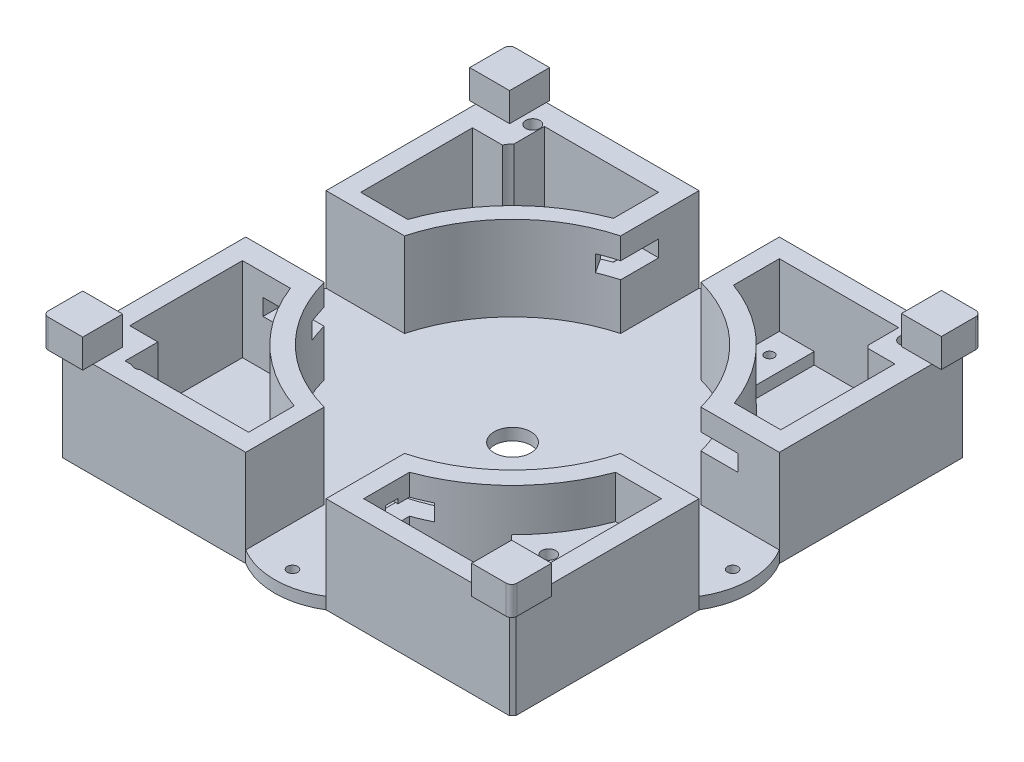
from build123d import *

# Parameters (mm, degrees)
BOSS_EXTRUDE1_DEPTH                  = 20.5
CUT_EXTRUDE4_REACH                   = 102.939
SKETCH2_R                            = 4.5
SKETCH2_R_2                          = 1.5
SKETCH2_R_3                          = 1.1
SKETCH2_R_4                          = 3.9
SKETCH2_R_5                          = 4.9
SKETCH2_R_6                          = 1
CUT_EXTRUDE7_START                   = -18
SKETCH3_R                            = 1.1
SKETCH3_R_2                          = 3.9
CUT_EXTRUDE7_DEPTH                   = 18
CUT_EXTRUDE8_START                   = -17.9
CUT_EXTRUDE8_DEPTH                   = 17.9
CUT_EXTRUDE9_DEPTH                   = 13.4
CUT_EXTRUDE10_DEPTH                  = 2.5
CUT_EXTRUDE11_START                  = -13.4
SKETCH7_R                            = 1
CUT_EXTRUDE11_DEPTH                  = 13.4
CUT_EXTRUDE12_START                  = -2.5
CUT_EXTRUDE12_DEPTH                  = 2.5
CUT_EXTRUDE13_START                  = -9.1
CUT_EXTRUDE13_DEPTH                  = 9.1
CUT_EXTRUDE14_START                  = -6.9
CUT_EXTRUDE14_DEPTH                  = 6.9
SKETCH11_W                           = 2.6
SKETCH11_H                           = 3.5
SKETCH11_W_2                         = 4.5
SKETCH11_H_2                         = 1
SKETCH11_W_3                         = 5.4
CUT_EXTRUDE15_DEPTH                  = 4
CUT_EXTRUDE16_REACH                  = 109.549
CUT_EXTRUDE16_END_RADIUS             = 32.7
SKETCH12_W                           = 6.7
SKETCH12_H                           = 3.5
CUT_EXTRUDE16_DIRECTION_2_REACH      = 109.549
CUT_EXTRUDE16_DIRECTION_2_END_RADIUS = 36.7
CUT_EXTRUDE17_REACH                  = 110.321
CUT_EXTRUDE17_END_RADIUS             = 36.7
SKETCH13_W                           = 6.711690568
SKETCH13_H                           = 3.5
SKETCH14_W                           = 8.3
SKETCH14_H                           = 3.5
CUT_EXTRUDE18_DEPTH                  = 4.7
CUT_EXTRUDE19_REACH                  = 120.941
CUT_EXTRUDE19_END_RADIUS             = 36.537172852
SKETCH15_W                           = 4.2
SKETCH15_H                           = 3.5
CUT_EXTRUDE19_DIRECTION_2_REACH      = 120.941
CUT_EXTRUDE19_DIRECTION_2_END_RADIUS = 32.7
CUT_EXTRUDE20_START                  = -0.346724082
CUT_EXTRUDE20_OUTLINE_W              = 1.5
CUT_EXTRUDE20_OUTLINE_H              = 3.5
CUT_EXTRUDE20_DEPTH                  = 3.492022821
CUT_EXTRUDE21_REACH                  = 95.558
SKETCH17_W                           = 3.89836408
SKETCH17_H                           = 3.5
CIRPATTERN1_START                    = 12.4
CIRPATTERN1_DEPTH                    = 3.5
SKETCH18_W                           = 8.1
SKETCH18_H                           = 3.5
CUT_EXTRUDE22_DEPTH                  = 4
CUT_EXTRUDE23_REACH                  = 82.562
SKETCH19_W                           = 7.9
SKETCH19_H                           = 3.5
BOSS_EXTRUDE2_DEPTH                  = 6.1


# Read off the part's stored shape, not the designer's step: Cut-Extrude20, CirPattern1
with BuildPart() as part:
    # Sketch1 → Boss-Extrude1 (new body)
    with BuildSketch(Plane(origin=(0, 0, 0), x_dir=(1, 0, 0), z_dir=(0, 1, 0))):
        with BuildLine():
            ThreePointArc((8.55, 14.0296875), (0, 16.4296875), (-8.55, 14.0296875))
            Line((-8.55, 14.0296875), (-47.55, 14.0296875))
            Line((-47.55, 14.0296875), (-48.25, 13.3296875))
            Line((-48.25, 13.3296875), (-48.25, -25.6703125))
            ThreePointArc((-48.25, -25.6703125), (-50.65, -34.2203125), (-48.25, -42.7703125))
            Line((-48.25, -42.7703125), (-48.25, -81.7703125))
            Line((-48.25, -81.7703125), (-47.55, -82.4703125))
            Line((-47.55, -82.4703125), (-8.55, -82.4703125))
            ThreePointArc((-8.55, -82.4703125), (0, -84.8703125), (8.55, -82.4703125))
            Line((8.55, -82.4703125), (47.55, -82.4703125))
            Line((47.55, -82.4703125), (48.25, -81.7703125))
            Line((48.25, -81.7703125), (48.25, -42.7703125))
            ThreePointArc((48.25, -42.7703125), (50.65, -34.2203125), (48.25, -25.6703125))
            Line((48.25, -25.6703125), (48.25, 13.3296875))
            Line((48.25, 13.3296875), (47.55, 14.0296875))
            Line((47.55, 14.0296875), (8.55, 14.0296875))
        make_face()
    extrude(amount=BOSS_EXTRUDE1_DEPTH)

    # Sketch2 → Cut-Extrude4 (cut, up to next)
    with BuildSketch(Plane.XZ, mode=Mode.PRIVATE) as cut_extrude4_sk1:
        with Locations(Location((34.75, 68.5703125, 0), (0, 0, 270))):
            Circle(SKETCH2_R)
    cut_extrude4_tool1 = extrude(cut_extrude4_sk1.sketch, amount=-CUT_EXTRUDE4_REACH, mode=Mode.PRIVATE) & part.part
    # Sketch2 → Cut-Extrude4 (cut, up to next)
    with BuildSketch(Plane.XZ, mode=Mode.PRIVATE) as cut_extrude4_sk2:
        with Locations(Location((33.45, 59.9703125, 0), (0, 0, 270))):
            Circle(SKETCH2_R_2)
    cut_extrude4_tool2 = extrude(cut_extrude4_sk2.sketch, amount=-CUT_EXTRUDE4_REACH, mode=Mode.PRIVATE) & part.part
    # Sketch2 → Cut-Extrude4 (cut, up to next)
    with BuildSketch(Plane.XZ, mode=Mode.PRIVATE) as cut_extrude4_sk3:
        with Locations(Location((37.85, 77.2703125, 0), (0, 0, 270))):
            Circle(SKETCH2_R_2)
    cut_extrude4_tool3 = extrude(cut_extrude4_sk3.sketch, amount=-CUT_EXTRUDE4_REACH, mode=Mode.PRIVATE) & part.part
    # Sketch2 → Cut-Extrude4 (cut, up to next)
    with BuildSketch(Plane.XZ, mode=Mode.PRIVATE) as cut_extrude4_sk4:
        with Locations(Location((-35.95, 77.2703125, 0), (0, 0, 270))):
            Circle(SKETCH2_R_2)
    cut_extrude4_tool4 = extrude(cut_extrude4_sk4.sketch, amount=-CUT_EXTRUDE4_REACH, mode=Mode.PRIVATE) & part.part
    # Sketch2 → Cut-Extrude4 (cut, up to next)
    with BuildSketch(Plane.XZ, mode=Mode.PRIVATE) as cut_extrude4_sk5:
        with Locations(Location((0, 81.0703125, 0), (0, 0, 270))):
            Circle(SKETCH2_R_3)
    cut_extrude4_tool5 = extrude(cut_extrude4_sk5.sketch, amount=-CUT_EXTRUDE4_REACH, mode=Mode.PRIVATE) & part.part
    # Sketch2 → Cut-Extrude4 (cut, up to next)
    with BuildSketch(Plane.XZ, mode=Mode.PRIVATE) as cut_extrude4_sk6:
        with Locations(Location((0, 34.2203125, 0), (0, 0, 270))):
            Circle(SKETCH2_R_4)
    cut_extrude4_tool6 = extrude(cut_extrude4_sk6.sketch, amount=-CUT_EXTRUDE4_REACH, mode=Mode.PRIVATE) & part.part
    # Sketch2 → Cut-Extrude4 (cut, up to next)
    with BuildSketch(Plane.XZ, mode=Mode.PRIVATE) as cut_extrude4_sk7:
        with Locations(Location((-34.25, -0.0296875, 0), (0, 0, 270))):
            Circle(SKETCH2_R_4)
    cut_extrude4_tool7 = extrude(cut_extrude4_sk7.sketch, amount=-CUT_EXTRUDE4_REACH, mode=Mode.PRIVATE) & part.part
    # Sketch2 → Cut-Extrude4 (cut, up to next)
    with BuildSketch(Plane.XZ, mode=Mode.PRIVATE) as cut_extrude4_sk8:
        with Locations(Location((34.55, -0.0296875, 0), (0, 0, 270))):
            Circle(SKETCH2_R_5)
    cut_extrude4_tool8 = extrude(cut_extrude4_sk8.sketch, amount=-CUT_EXTRUDE4_REACH, mode=Mode.PRIVATE) & part.part
    # Sketch2 → Cut-Extrude4 (cut, up to next)
    with BuildSketch(Plane.XZ, mode=Mode.PRIVATE) as cut_extrude4_sk9:
        with Locations(Location((41.15, -8.5296875, 0), (0, 0, 270))):
            Circle(SKETCH2_R_2)
    cut_extrude4_tool9 = extrude(cut_extrude4_sk9.sketch, amount=-CUT_EXTRUDE4_REACH, mode=Mode.PRIVATE) & part.part
    # Sketch2 → Cut-Extrude4 (cut, up to next)
    with BuildSketch(Plane.XZ, mode=Mode.PRIVATE) as cut_extrude4_sk10:
        with Locations(Location((-15.25, -4.6296875, 0), (0, 0, 270))):
            Circle(SKETCH2_R_6)
    cut_extrude4_tool10 = extrude(cut_extrude4_sk10.sketch, amount=-CUT_EXTRUDE4_REACH, mode=Mode.PRIVATE) & part.part
    # Sketch2 → Cut-Extrude4 (cut, up to next)
    with BuildSketch(Plane.XZ, mode=Mode.PRIVATE) as cut_extrude4_sk11:
        with Locations(Location((46.85, 34.2203125, 0), (0, 0, 270))):
            Circle(SKETCH2_R_3)
    cut_extrude4_tool11 = extrude(cut_extrude4_sk11.sketch, amount=-CUT_EXTRUDE4_REACH, mode=Mode.PRIVATE) & part.part
    # Sketch2 → Cut-Extrude4 (cut, up to next)
    with BuildSketch(Plane.XZ, mode=Mode.PRIVATE) as cut_extrude4_sk12:
        with Locations(Location((38.95, 18.3703125, 0), (0, 0, 270))):
            Circle(SKETCH2_R_6)
    cut_extrude4_tool12 = extrude(cut_extrude4_sk12.sketch, amount=-CUT_EXTRUDE4_REACH, mode=Mode.PRIVATE) & part.part
    # Sketch2 → Cut-Extrude4 (cut, up to next)
    with BuildSketch(Plane.XZ, mode=Mode.PRIVATE) as cut_extrude4_sk13:
        with Locations(Location((15.85, -4.6296875, 0), (0, 0, 270))):
            Circle(SKETCH2_R_6)
    cut_extrude4_tool13 = extrude(cut_extrude4_sk13.sketch, amount=-CUT_EXTRUDE4_REACH, mode=Mode.PRIVATE) & part.part
    # Sketch2 → Cut-Extrude4 (cut, up to next)
    with BuildSketch(Plane.XZ, mode=Mode.PRIVATE) as cut_extrude4_sk14:
        with Locations(Location((-46.85, 34.2203125, 0), (0, 0, 270))):
            Circle(SKETCH2_R_3)
    cut_extrude4_tool14 = extrude(cut_extrude4_sk14.sketch, amount=-CUT_EXTRUDE4_REACH, mode=Mode.PRIVATE) & part.part
    # Sketch2 → Cut-Extrude4 (cut, up to next)
    with BuildSketch(Plane.XZ, mode=Mode.PRIVATE) as cut_extrude4_sk15:
        with Locations(Location((-38.55, 18.6703125, 0), (0, 0, 270))):
            Circle(SKETCH2_R_3)
    cut_extrude4_tool15 = extrude(cut_extrude4_sk15.sketch, amount=-CUT_EXTRUDE4_REACH, mode=Mode.PRIVATE) & part.part
    # Sketch2 → Cut-Extrude4 (cut, up to next)
    with BuildSketch(Plane.XZ, mode=Mode.PRIVATE) as cut_extrude4_sk16:
        with Locations(Location((-38.45, -8.5296875, 0), (0, 0, 270))):
            Circle(SKETCH2_R_2)
    cut_extrude4_tool16 = extrude(cut_extrude4_sk16.sketch, amount=-CUT_EXTRUDE4_REACH, mode=Mode.PRIVATE) & part.part
    # Sketch2 → Cut-Extrude4 (cut, up to next)
    with BuildSketch(Plane.XZ, mode=Mode.PRIVATE) as cut_extrude4_sk17:
        with Locations(Location((0, -12.6296875, 0), (0, 0, 270))):
            Circle(SKETCH2_R_3)
    cut_extrude4_tool17 = extrude(cut_extrude4_sk17.sketch, amount=-CUT_EXTRUDE4_REACH, mode=Mode.PRIVATE) & part.part
    add(cut_extrude4_tool1.solids().sort_by_distance((34.75, 0, 68.570313))[0], mode=Mode.SUBTRACT)
    add(cut_extrude4_tool2.solids().sort_by_distance((33.45, 0, 59.970312))[0], mode=Mode.SUBTRACT)
    add(cut_extrude4_tool3.solids().sort_by_distance((37.85, 0, 77.270313))[0], mode=Mode.SUBTRACT)
    add(cut_extrude4_tool4.solids().sort_by_distance((-35.95, 0, 77.270313))[0], mode=Mode.SUBTRACT)
    add(cut_extrude4_tool5.solids().sort_by_distance((0, 0, 81.070312))[0], mode=Mode.SUBTRACT)
    add(cut_extrude4_tool6.solids().sort_by_distance((0, 0, 34.220313))[0], mode=Mode.SUBTRACT)
    add(cut_extrude4_tool7.solids().sort_by_distance((-34.25, 0, -0.029688))[0], mode=Mode.SUBTRACT)
    add(cut_extrude4_tool8.solids().sort_by_distance((34.55, 0, -0.029688))[0], mode=Mode.SUBTRACT)
    add(cut_extrude4_tool9.solids().sort_by_distance((41.15, 0, -8.529688))[0], mode=Mode.SUBTRACT)
    add(cut_extrude4_tool10.solids().sort_by_distance((-15.25, 0, -4.629688))[0], mode=Mode.SUBTRACT)
    add(cut_extrude4_tool11.solids().sort_by_distance((46.85, 0, 34.220313))[0], mode=Mode.SUBTRACT)
    add(cut_extrude4_tool12.solids().sort_by_distance((38.95, 0, 18.370312))[0], mode=Mode.SUBTRACT)
    add(cut_extrude4_tool13.solids().sort_by_distance((15.85, 0, -4.629688))[0], mode=Mode.SUBTRACT)
    add(cut_extrude4_tool14.solids().sort_by_distance((-46.85, 0, 34.220312))[0], mode=Mode.SUBTRACT)
    add(cut_extrude4_tool15.solids().sort_by_distance((-38.55, 0, 18.670313))[0], mode=Mode.SUBTRACT)
    add(cut_extrude4_tool16.solids().sort_by_distance((-38.45, 0, -8.529688))[0], mode=Mode.SUBTRACT)
    add(cut_extrude4_tool17.solids().sort_by_distance((0, 0, -12.629688))[0], mode=Mode.SUBTRACT)

    # Sketch3 → Cut-Extrude7 (cut)
    with BuildSketch(Plane(origin=(0, 20.5, 0), x_dir=(1, 0, 0), z_dir=(0, 1, 0)).offset(CUT_EXTRUDE7_START)):
        with BuildLine():
            Line((8.55, -82.4703125), (8.55, -65.782750619))
            ThreePointArc((8.55, -65.782750619), (23.122391745, -57.342704245), (31.562438119, -42.7703125))
            Line((31.562438119, -42.7703125), (48.25, -42.7703125))
            ThreePointArc((48.25, -42.7703125), (50.65, -34.2203125), (48.25, -25.6703125))
            Line((48.25, -25.6703125), (31.562438119, -25.6703125))
            ThreePointArc((31.562438119, -25.6703125), (23.122391745, -11.097920755), (8.55, -2.657874381))
            Line((8.55, -2.657874381), (8.55, 14.0296875))
            ThreePointArc((8.55, 14.0296875), (0, 16.4296875), (-8.55, 14.0296875))
            Line((-8.55, 14.0296875), (-8.55, -2.657874381))
            ThreePointArc((-8.55, -2.657874381), (-23.122391745, -11.097920755), (-31.562438119, -25.6703125))
            Line((-31.562438119, -25.6703125), (-48.25, -25.6703125))
            ThreePointArc((-48.25, -25.6703125), (-50.65, -34.2203125), (-48.25, -42.7703125))
            Line((-48.25, -42.7703125), (-31.562438119, -42.7703125))
            ThreePointArc((-31.562438119, -42.7703125), (-23.122391745, -57.342704245), (-8.55, -65.782750619))
            Line((-8.55, -65.782750619), (-8.55, -82.4703125))
            ThreePointArc((-8.55, -82.4703125), (0, -84.8703125), (8.55, -82.4703125))
        make_face()
        with Locations(Location((0, -81.0703125, 0), (0, 0, 90))):
            Circle(SKETCH3_R, mode=Mode.SUBTRACT)
        with Locations(Location((-46.85, -34.2203125, 0), (0, 0, 90))):
            Circle(SKETCH3_R, mode=Mode.SUBTRACT)
        with Locations(Location((46.85, -34.2203125, 0), (0, 0, 90))):
            Circle(SKETCH3_R, mode=Mode.SUBTRACT)
        with Locations(Location((0, 12.6296875, 0), (0, 0, 90))):
            Circle(SKETCH3_R, mode=Mode.SUBTRACT)
        with Locations(Location((0, -34.2203125, 0), (0, 0, 90))):
            Circle(SKETCH3_R_2, mode=Mode.SUBTRACT)
    extrude(amount=CUT_EXTRUDE7_DEPTH, mode=Mode.SUBTRACT)

    # Sketch4 → Cut-Extrude8 (cut)
    with BuildSketch(Plane(origin=(0, 20.5, 0), x_dir=(1, 0, 0), z_dir=(0, 1, 0)).offset(CUT_EXTRUDE8_START)):
        with BuildLine():
            Line((-34.05, -47.4703125), (-44.25, -47.4703125))
            Line((-44.25, -47.4703125), (-44.25, -71.4703125))
            Line((-44.25, -71.4703125), (-38.25, -71.4703125))
            Line((-38.25, -71.4703125), (-38.25, -78.4703125))
            Line((-38.25, -78.4703125), (-36.85, -78.4703125))
            ThreePointArc((-36.85, -78.4703125), (-36.620820393, -75.928671714), (-34.45, -77.2703125))
            ThreePointArc((-34.45, -77.2703125), (-34.608359214, -77.941132893), (-35.05, -78.4703125))
            Line((-35.05, -78.4703125), (-11.95, -78.4703125))
            Line((-11.95, -78.4703125), (-11.95, -68.748018766))
            ThreePointArc((-11.95, -68.748018766), (-25.341373206, -60.541023053), (-34.05, -47.4703125))
        make_face()
    extrude(amount=CUT_EXTRUDE8_DEPTH, mode=Mode.SUBTRACT)

    # Sketch5 → Cut-Extrude9 (cut)
    with BuildSketch(Plane(origin=(0, 20.5, 0), x_dir=(1, 0, 0), z_dir=(0, 1, 0))):
        with BuildLine():
            ThreePointArc((-34.25, -22.293841912), (-25.877838009, -8.81085165), (-12.55, -0.193841912))
            Line((-12.55, -0.193841912), (-12.55, 9.406158088))
            Line((-12.55, 9.406158088), (-36.85, 9.406158088))
            Line((-36.85, 9.406158088), (-36.85, 1.506158088))
            Line((-36.85, 1.506158088), (-44.25, 1.506158088))
            Line((-44.25, 1.506158088), (-44.25, -22.293841912))
            Line((-44.25, -22.293841912), (-34.25, -22.293841912))
        make_face()
    extrude(amount=-CUT_EXTRUDE9_DEPTH, mode=Mode.SUBTRACT)

    # Sketch6 → Cut-Extrude10 (cut)
    with BuildSketch(Plane(origin=(0, 7.1, 0), x_dir=(1, 0, 0), z_dir=(0, 1, 0))):
        with BuildLine():
            Line((-44.25, -16.293841912), (-31.526890949, -16.293841912))
            ThreePointArc((-31.526890949, -16.293841912), (-25.645019427, -8.575894408), (-17.927209848, -2.693841912))
            Line((-17.927209848, -2.693841912), (-17.927209848, 9.406158088))
            Line((-17.927209848, 9.406158088), (-36.85, 9.406158088))
            Line((-36.85, 9.406158088), (-36.85, 2.936575871))
            ThreePointArc((-36.85, 2.936575871), (-37.436167056, 2.278762753), (-37.859713922, 1.506158088))
            Line((-37.859713922, 1.506158088), (-44.25, 1.506158088))
            Line((-44.25, 1.506158088), (-44.25, -16.293841912))
        make_face()
    extrude(amount=-CUT_EXTRUDE10_DEPTH, mode=Mode.SUBTRACT)

    # Sketch7 → Cut-Extrude11 (cut)
    with BuildSketch(Plane(origin=(0, 20.5, 0), x_dir=(1, 0, 0), z_dir=(0, 1, 0)).offset(CUT_EXTRUDE11_START)):
        with BuildLine():
            Line((34.376845405, -21.3703125), (44.25, -21.3703125))
            Line((44.25, -21.3703125), (44.25, 2.9296875))
            Line((44.25, 2.9296875), (38.499683532, 2.9296875))
            ThreePointArc((38.499683532, 2.9296875), (39.206363887, 1.555556219), (39.45, 0.0296875))
            ThreePointArc((39.45, 0.0296875), (30.040565446, -1.887341451), (37.95, 3.558143253))
            Line((37.95, 3.558143253), (37.95, 10.0296875))
            Line((37.95, 10.0296875), (12.55, 10.0296875))
            Line((12.55, 10.0296875), (12.55, 0.267185235))
            ThreePointArc((12.55, 0.267185235), (25.837521785, -8.156689037), (34.376845405, -21.3703125))
        make_face()
        with Locations(Location((38.95, -18.3703125, 0), (0, 0, 90))):
            Circle(SKETCH7_R, mode=Mode.SUBTRACT)
        with Locations(Location((15.85, 4.6296875, 0), (0, 0, 90))):
            Circle(SKETCH7_R, mode=Mode.SUBTRACT)
    extrude(amount=CUT_EXTRUDE11_DEPTH, mode=Mode.SUBTRACT)

    # Sketch8 → Cut-Extrude12 (cut)
    with BuildSketch(Plane(origin=(0, 7.1, 0), x_dir=(1, 0, 0), z_dir=(0, 1, 0)).offset(CUT_EXTRUDE12_START)):
        with BuildLine():
            Line((19.975913663, 10.0296875), (19.975913663, -3.433093182))
            ThreePointArc((19.975913663, -3.433093182), (25.433957761, -7.762727716), (29.975474095, -13.04577702))
            Line((29.975474095, -13.04577702), (44.25, -13.04577702))
            Line((44.25, -13.04577702), (44.25, 2.9296875))
            Line((44.25, 2.9296875), (38.499683532, 2.9296875))
            ThreePointArc((38.499683532, 2.9296875), (38.238251776, 3.255644542), (37.95, 3.558143253))
            Line((37.95, 3.558143253), (37.95, 10.0296875))
            Line((37.95, 10.0296875), (19.975913663, 10.0296875))
        make_face()
    extrude(amount=CUT_EXTRUDE12_DEPTH, mode=Mode.SUBTRACT)

    # Sketch9 → Cut-Extrude13 (cut)
    with BuildSketch(Plane(origin=(0, 20.5, 0), x_dir=(1, 0, 0), z_dir=(0, 1, 0)).offset(CUT_EXTRUDE13_START)):
        with BuildLine():
            Line((44.25, -46.7703125), (44.25, -72.1703125))
            Line((44.25, -72.1703125), (37.65, -72.1703125))
            Line((37.65, -72.1703125), (37.65, -75.783705625))
            ThreePointArc((37.65, -75.783705625), (39.301538537, -77.64851334), (36.95, -78.4703125))
            Line((36.95, -78.4703125), (12.55, -78.4703125))
            Line((12.55, -78.4703125), (12.55, -68.707810235))
            ThreePointArc((12.55, -68.707810235), (25.95081887, -60.17113137), (34.487497735, -46.7703125))
            Line((34.487497735, -46.7703125), (44.25, -46.7703125))
        make_face()
    extrude(amount=CUT_EXTRUDE13_DEPTH, mode=Mode.SUBTRACT)

    # Sketch10 → Cut-Extrude14 (cut)
    with BuildSketch(Plane(origin=(0, 11.4, 0), x_dir=(1, 0, 0), z_dir=(0, 1, 0)).offset(CUT_EXTRUDE14_START)):
        with BuildLine():
            Line((37.65, -75.783705625), (37.65, -72.1703125))
            Line((37.65, -72.1703125), (37.563057618, -72.08267735))
            ThreePointArc((37.563057618, -72.08267735), (31.55541773, -71.739641155), (31.26007127, -65.729468003))
            Line((31.26007127, -65.729468003), (25.847635919, -60.273905677))
            ThreePointArc((25.847635919, -60.273905677), (19.656482329, -65.212451865), (12.55, -68.707810235))
            Line((12.55, -68.707810235), (12.55, -78.4703125))
            Line((12.55, -78.4703125), (36.95, -78.4703125))
            ThreePointArc((36.95, -78.4703125), (36.398461463, -76.89211166), (37.65, -75.783705625))
        make_face()
    extrude(amount=CUT_EXTRUDE14_DEPTH, mode=Mode.SUBTRACT)

    # Sketch11 → Cut-Extrude15 (cut)
    with BuildSketch(Plane.ZY.offset(-8.55)):
        with Locations((72.482750619, 14.15)):
            Rectangle(SKETCH11_W, SKETCH11_H)
        with Locations((76.032750619, 14.15)):
            Rectangle(SKETCH11_W_2, SKETCH11_H)
        with Locations((72.482750619, 16.4)):
            Rectangle(SKETCH11_W, SKETCH11_H_2)
        with Locations((72.482750619, 11.9)):
            Rectangle(SKETCH11_W, SKETCH11_H_2)
        with Locations((68.482750619, 14.15)):
            Rectangle(SKETCH11_W_3, SKETCH11_H)
    extrude(amount=-CUT_EXTRUDE15_DEPTH, mode=Mode.SUBTRACT)

    # Cut-Extrude16: up to this cylinder (the profile starts outside it)
    cut_extrude16_end = Plane(origin=(0, 14.15, 34.2203125), z_dir=(0, 1, 0)) * Cylinder(CUT_EXTRUDE16_END_RADIUS, 285.498, mode=Mode.PRIVATE)
    # Sketch12 → Cut-Extrude16 (cut, up to the surface)
    with BuildSketch(Plane(origin=(19.808215468, 0, 62.197303242), x_dir=(0.9528453446101641, 0, -0.3034563383004839), z_dir=(0.3034563383004839, 0, 0.9528453446101641)), mode=Mode.PRIVATE) as cut_extrude16_sk1:
        with Locations((-8.46536493, 14.15)):
            Rectangle(SKETCH12_W, SKETCH12_H)
    cut_extrude16_tool1 = extrude(cut_extrude16_sk1.sketch, amount=-CUT_EXTRUDE16_REACH, mode=Mode.PRIVATE) - cut_extrude16_end
    add(cut_extrude16_tool1.solids().sort_by_distance((11.742032, 14.15, 64.766172))[0], mode=Mode.SUBTRACT)

    # Cut-Extrude16 direction 2: up to this cylinder (the profile starts inside it)
    cut_extrude16_direction_2_end = Plane(origin=(0, 14.15, 34.2203125), z_dir=(0, 1, 0)) * Cylinder(CUT_EXTRUDE16_DIRECTION_2_END_RADIUS, 293.498, mode=Mode.PRIVATE)
    # Sketch12 → Cut-Extrude16 direction 2 (cut, up to the surface)
    with BuildSketch(Plane(origin=(19.808215468, 0, 62.197303242), x_dir=(0.9528453446101641, 0, -0.3034563383004839), z_dir=(0.3034563383004839, 0, 0.9528453446101641)), mode=Mode.PRIVATE) as cut_extrude16_direction_2_sk1:
        with Locations((-8.46536493, 14.15)):
            Rectangle(SKETCH12_W, SKETCH12_H)
    cut_extrude16_direction_2_tool1 = extrude(cut_extrude16_direction_2_sk1.sketch, amount=CUT_EXTRUDE16_DIRECTION_2_REACH, mode=Mode.PRIVATE) & cut_extrude16_direction_2_end
    add(cut_extrude16_direction_2_tool1.solids().sort_by_distance((11.742032, 14.15, 64.766172))[0], mode=Mode.SUBTRACT)

    # Cut-Extrude17: up to this cylinder (the profile starts inside it)
    cut_extrude17_end = Plane(origin=(0, 14.15, 34.2203125), z_dir=(0, 1, 0)) * Cylinder(CUT_EXTRUDE17_END_RADIUS, 295.042, mode=Mode.PRIVATE)
    # Sketch13 → Cut-Extrude17 (cut, up to the surface)
    with BuildSketch(Plane(origin=(23.151967775, 0, 60.163674119), x_dir=(-0.9332827385163521, 3.2843925015086386e-15, 0.3591424925950957), z_dir=(-0.3591424925950957, -8.534960054494017e-15, -0.9332827385163521)), mode=Mode.PRIVATE) as cut_extrude17_sk1:
        with Locations((12.289968329, 14.15)):
            Rectangle(SKETCH13_W, SKETCH13_H)
    cut_extrude17_tool1 = extrude(cut_extrude17_sk1.sketch, amount=-CUT_EXTRUDE17_REACH, mode=Mode.PRIVATE) & cut_extrude17_end
    add(cut_extrude17_tool1.solids().sort_by_distance((11.681952, 14.15, 64.577524))[0], mode=Mode.SUBTRACT)

    # Sketch14 → Cut-Extrude18 (cut)
    with BuildSketch(Plane(origin=(0, 0, 42.7703125), x_dir=(-1, 0, 0), z_dir=(0, 0, -1))):
        with Locations((35.712438119, 14.15)):
            Rectangle(SKETCH14_W, SKETCH14_H)
    extrude(amount=-CUT_EXTRUDE18_DEPTH, mode=Mode.SUBTRACT)

    # Cut-Extrude19: up to this cylinder (the profile starts inside it)
    cut_extrude19_end = Plane(origin=(0, 14.15, 34.2203125), z_dir=(0, 1, 0)) * Cylinder(CUT_EXTRUDE19_END_RADIUS, 315.956345704, mode=Mode.PRIVATE)
    # Sketch15 → Cut-Extrude19 (cut, up to the surface)
    with BuildSketch(Plane(origin=(-40.198686506, 0, 10.889487318), x_dir=(-0.261467889908257, 0, -0.9652121748853584), z_dir=(0.9652121748853584, 0, -0.261467889908257)), mode=Mode.PRIVATE) as cut_extrude19_sk1:
        with Locations((-35.129862253, 14.15)):
            Rectangle(SKETCH15_W, SKETCH15_H)
    cut_extrude19_tool1 = extrude(cut_extrude19_sk1.sketch, amount=-CUT_EXTRUDE19_REACH, mode=Mode.PRIVATE) & cut_extrude19_end
    add(cut_extrude19_tool1.solids().sort_by_distance((-31.013356, 14.15, 44.797258))[0], mode=Mode.SUBTRACT)

    # Cut-Extrude19 direction 2: up to this cylinder (the profile starts outside it)
    cut_extrude19_direction_2_end = Plane(origin=(0, 14.15, 34.2203125), z_dir=(0, 1, 0)) * Cylinder(CUT_EXTRUDE19_DIRECTION_2_END_RADIUS, 308.282, mode=Mode.PRIVATE)
    # Sketch15 → Cut-Extrude19 direction 2 (cut, up to the surface)
    with BuildSketch(Plane(origin=(-40.198686506, 0, 10.889487318), x_dir=(-0.261467889908257, 0, -0.9652121748853584), z_dir=(0.9652121748853584, 0, -0.261467889908257)), mode=Mode.PRIVATE) as cut_extrude19_direction_2_sk1:
        with Locations((-35.129862253, 14.15)):
            Rectangle(SKETCH15_W, SKETCH15_H)
    cut_extrude19_direction_2_tool1 = extrude(cut_extrude19_direction_2_sk1.sketch, amount=CUT_EXTRUDE19_DIRECTION_2_REACH, mode=Mode.PRIVATE) - cut_extrude19_direction_2_end
    add(cut_extrude19_direction_2_tool1.solids().sort_by_distance((-31.013356, 14.15, 44.797258))[0], mode=Mode.SUBTRACT)

    # Cut-Extrude20 outline → Cut-Extrude20 (cut)
    with BuildSketch(Plane(origin=(-45.01415134, 0, 32.090733697), x_dir=(-0.5804925454635855, 0, -0.8142655615100071), z_dir=(0.8142655615100071, 0, -0.5804925454635855)).offset(CUT_EXTRUDE20_START)):
        with Locations((-19.63766949, 14.15)):
            Rectangle(CUT_EXTRUDE20_OUTLINE_W, CUT_EXTRUDE20_OUTLINE_H)
    extrude(amount=CUT_EXTRUDE20_DEPTH, mode=Mode.SUBTRACT)

    # Sketch17 → Cut-Extrude21 (cut, up to next)
    with BuildSketch(Plane(origin=(12.352092506, 0, 18.813009722), x_dir=(0.8359244810093499, 0, -0.5488444789275456), z_dir=(0.5488444789275456, 0, 0.83592448100935)), mode=Mode.PRIVATE) as cut_extrude21_sk1:
        with Locations((-52.856820426, 14.15)):
            Rectangle(SKETCH17_W, SKETCH17_H)
    cut_extrude21_tool1 = extrude(cut_extrude21_sk1.sketch, amount=-CUT_EXTRUDE21_REACH, mode=Mode.PRIVATE) & part.part
    add(cut_extrude21_tool1.solids().sort_by_distance((-31.832218, 14.15, 47.823184))[0], mode=Mode.SUBTRACT)

    # CirPattern1 outline → CirPattern1 (cut)
    with BuildSketch(Plane(origin=(0, 0, 0), x_dir=(1, 0, 0), z_dir=(0, 1, 0)).offset(CIRPATTERN1_START)):
        with BuildLine():
            Line((-8.55, -2.657874381), (-9.553297489, 1.045811572))
            ThreePointArc((-9.553297489, 1.045811572), (-11.061893711, 0.602087009), (-12.55, 0.093860956))
            Line((-12.55, 0.093860956), (-12.55, -0.193841912))
            ThreePointArc((-12.55, -0.193841912), (-13.541978739, -0.576323252), (-14.522320096, -0.987716759))
            Line((-14.522320096, -0.987716759), (-12.533073485, -4.017463809))
            ThreePointArc((-12.533073485, -4.017463809), (-10.563433047, -3.273521353), (-8.55, -2.657874381))
        make_face()
        with BuildLine():
            Line((31.562438119, -25.6703125), (35.266124072, -24.667015011))
            ThreePointArc((35.266124072, -24.667015011), (34.707314308, -22.802460971), (34.05, -20.9703125))
            Line((34.05, -20.9703125), (34.186757414, -20.872817698))
            ThreePointArc((34.186757414, -20.872817698), (33.899345088, -20.158861559), (33.59702441, -19.451089405))
            Line((33.59702441, -19.451089405), (33.461586661, -19.547643413))
            Line((33.461586661, -19.547643413), (30.202848691, -21.687239015))
            ThreePointArc((30.202848691, -21.687239015), (30.946791147, -23.656879453), (31.562438119, -25.6703125))
        make_face()
    extrude(amount=CIRPATTERN1_DEPTH, mode=Mode.SUBTRACT)

    # Sketch18 → Cut-Extrude22 (cut)
    with BuildSketch(Plane(origin=(-8.55, 0, 0), x_dir=(0, 0, -1), z_dir=(1, 0, 0))):
        with Locations((1.392125619, 14.15)):
            Rectangle(SKETCH18_W, SKETCH18_H)
    extrude(amount=-CUT_EXTRUDE22_DEPTH, mode=Mode.SUBTRACT)

    # Cut-Extrude23: up to this face of the body (flat: up to its plane)
    cut_extrude23_end = Plane(part.part.faces().sort_by_distance((34.118378707, 14.15, 20.921565099))[0])
    # Sketch19 → Cut-Extrude23 (cut, up to the picked face)
    with BuildSketch(Plane.XY.offset(25.6703125), mode=Mode.PRIVATE) as cut_extrude23_sk1:
        with Locations((35.512438119, 14.15)):
            Rectangle(SKETCH19_W, SKETCH19_H)
    cut_extrude23_tool1 = split(extrude(cut_extrude23_sk1.sketch, amount=-CUT_EXTRUDE23_REACH, mode=Mode.PRIVATE), bisect_by=cut_extrude23_end, keep=Keep.BOTH, mode=Mode.PRIVATE)
    add(cut_extrude23_tool1.solids().sort_by(Axis((35.512438, 14.15, 25.670313), (0, 0, -1)))[0], mode=Mode.SUBTRACT)

    # Sketch20 → Boss-Extrude2 (add)
    with BuildSketch(Plane(origin=(0, 20.5, 0), x_dir=(1, 0, 0), z_dir=(0, 1, 0))):
        with BuildLine():
            Line((42.05, -76.4703125), (50.55, -76.4703125))
            Line((50.55, -76.4703125), (50.55, -83.8203125))
            ThreePointArc((50.55, -83.8203125), (50.213172798, -84.633485298), (49.4, -84.9703125))
            Line((49.4, -84.9703125), (42.05, -84.9703125))
            Line((42.05, -84.9703125), (42.05, -76.4703125))
        make_face()
        with BuildLine():
            Line((41.75, 15.3296875), (49.05, 15.3296875))
            ThreePointArc((49.05, 15.3296875), (49.898528137, 14.978215637), (50.25, 14.1296875))
            Line((50.25, 14.1296875), (50.25, 6.8296875))
            Line((50.25, 6.8296875), (41.75, 6.8296875))
            Line((41.75, 6.8296875), (41.75, 15.3296875))
        make_face()
        with BuildLine():
            Line((-41.05, 14.706158088), (-48.4, 14.706158088))
            ThreePointArc((-48.4, 14.706158088), (-49.213172798, 14.369330887), (-49.55, 13.556158088))
            Line((-49.55, 13.556158088), (-49.55, 6.206158088))
            Line((-49.55, 6.206158088), (-41.05, 6.206158088))
            Line((-41.05, 6.206158088), (-41.05, 14.706158088))
        make_face()
        with BuildLine():
            Line((-41.05, -76.1703125), (-49.55, -76.1703125))
            Line((-49.55, -76.1703125), (-49.55, -83.5203125))
            ThreePointArc((-49.55, -83.5203125), (-49.213172798, -84.333485298), (-48.4, -84.6703125))
            Line((-48.4, -84.6703125), (-41.05, -84.6703125))
            Line((-41.05, -84.6703125), (-41.05, -76.1703125))
        make_face()
    extrude(amount=BOSS_EXTRUDE2_DEPTH)


solid = part.part
